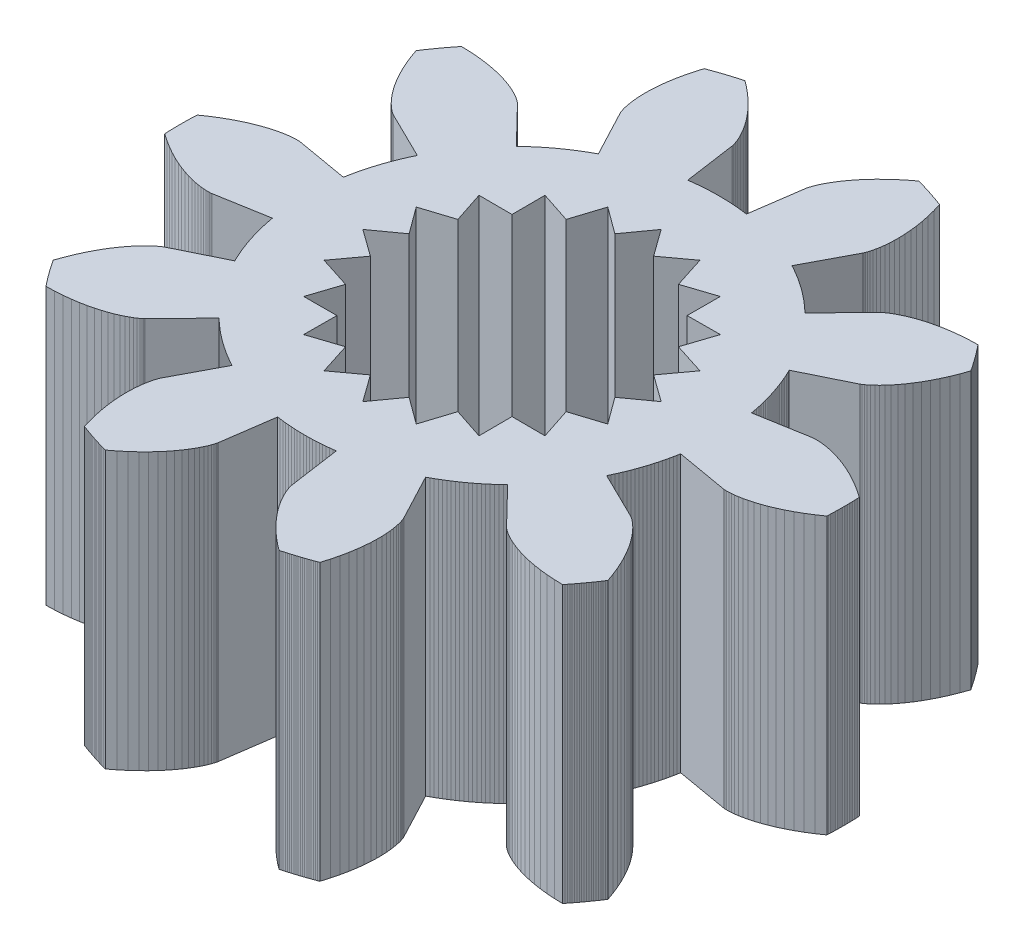
from build123d import *

# Parameters (mm, degrees)
BOSS_EXTRUDE1_DEPTH = 5
SKETCH2_R           = 1.5
CUT_EXTRUDE1_DEPTH  = 10.722497268
CUT_EXTRUDE2_DEPTH  = 10.722497268


with BuildPart() as part:
    # Sketch1 → Boss-Extrude1 (new body)
    with BuildSketch(Plane(origin=(0, 0, 0), x_dir=(1, 0, 0), z_dir=(0, 1, 0))):
        Polygon((3.6946769, -0.6417654), (4.6291475, -0.8040829), (4.6332094, -0.8046724), (4.6454524, -0.8059869), (4.6659298, -0.8073423), (4.6946521, -0.8080515), (4.7315867, -0.8074275), (4.7766581, -0.8047855), (4.8297479, -0.7994452), (4.8906949, -0.7907331), (4.9592959, -0.7779854), (5.035306, -0.7605497), (5.1184393, -0.7377878), (5.2083696, -0.7090775), (5.3047313, -0.6738155), (5.4071205, -0.631419), (5.515096, -0.5813282), (5.6281806, -0.523008), (5.7458624, -0.4559506), (5.8675963, -0.379677), (5.9928055, -0.2937389), (5.9942402, -0.26284), (5.9955155, -0.2319341), (5.9966316, -0.201022), (5.9975882, -0.1701046), (5.9983855, -0.1391826), (5.9990233, -0.108257), (5.9995017, -0.0773285), (5.9998206, -0.0463979), (5.9999801, -0.0154661), (5.9999801, 0.0154661), (5.9998206, 0.0463979), (5.9995017, 0.0773285), (5.9990233, 0.108257), (5.9983855, 0.1391826), (5.9975882, 0.1701046), (5.9966316, 0.201022), (5.9955155, 0.2319341), (5.9942402, 0.26284), (5.9928055, 0.2937389), (5.8675963, 0.379677), (5.7458624, 0.4559506), (5.6281806, 0.523008), (5.515096, 0.5813282), (5.4071205, 0.631419), (5.3047313, 0.6738155), (5.2083696, 0.7090775), (5.1184393, 0.7377878), (5.035306, 0.7605497), (4.9592959, 0.7779854), (4.8906949, 0.7907331), (4.8297479, 0.7994452), (4.7766581, 0.8047855), (4.7315867, 0.8074275), (4.6946521, 0.8080515), (4.6659298, 0.8073423), (4.6454524, 0.8059869), (4.6332094, 0.8046724), (4.6291475, 0.8040829), (3.6946769, 0.6417654), (3.6846589, 0.6969853), (3.6738157, 0.7520491), (3.6621497, 0.8069445), (3.6496635, 0.8616591), (3.6363598, 0.9161808), (3.6222417, 0.9704972), (3.6073123, 1.0245963), (3.591575, 1.078466), (3.5750333, 1.132094), (3.5576909, 1.1854685), (3.5395516, 1.2385775), (3.5206196, 1.2914091), (3.5008991, 1.3439515), (3.4803944, 1.3961929), (3.4591103, 1.4481215), (3.4370514, 1.4997258), (3.4142227, 1.5509942), (3.3906294, 1.6019152), (3.3662766, 1.6524775), (4.217687, 2.0704279), (4.2213197, 2.0723385), (4.2319972, 2.0784713), (4.2493604, 2.0894111), (4.2730141, 2.1057199), (4.3025281, 2.1279343), (4.3374387, 2.156564), (4.3772502, 2.1920898), (4.4214365, 2.2349618), (4.469443, 2.2855975), (4.520688, 2.3443809), (4.5745651, 2.4116603), (4.6304448, 2.4877471), (4.6876766, 2.5729146), (4.7455911, 2.6673969), (4.8035025, 2.7713877), (4.8607101, 2.8850392), (4.9165014, 3.0084614), (4.9701537, 3.1417214), (5.0209369, 3.2848429), (5.0039356, 3.3106839), (4.9868014, 3.336437), (4.9695346, 3.3621014), (4.9521358, 3.3876764), (4.9346053, 3.4131614), (4.9169437, 3.4385557), (4.8991514, 3.4638585), (4.8812288, 3.4890694), (4.8631766, 3.5141875), (4.8449951, 3.5392121), (4.8266848, 3.5641428), (4.8082463, 3.5889787), (4.7896799, 3.6137192), (4.7709863, 3.6383636), (4.7521658, 3.6629114), (4.7332191, 3.6873618), (4.7141465, 3.7117142), (4.6949487, 3.735968), (4.6756261, 3.7601225), (4.5238166, 3.7560517), (4.3804993, 3.746205), (4.2458773, 3.7312839), (4.1201102, 3.7119964), (4.0033136, 3.6890544), (3.8955589, 3.663171), (3.7968742, 3.6350586), (3.7072436, 3.605426), (3.6266082, 3.5749763), (3.5548663, 3.5444044), (3.491874, 3.5143949), (3.437446, 3.4856193), (3.3913565, 3.4587344), (3.3533401, 3.4343795), (3.3230926, 3.4131746), (3.3002726, 3.3957183), (3.2845027, 3.3825855), (3.2753706, 3.3743258), (3.2724309, 3.3714613), (2.6118362, 2.6908757), (2.571274, 2.7296611), (2.530136, 2.7678352), (2.4884313, 2.8053894), (2.4461693, 2.8423152), (2.4033593, 2.8786045), (2.3600111, 2.914249), (2.3161344, 2.9492408), (2.2717388, 2.9835721), (2.2268345, 3.0172352), (2.1814314, 3.0502224), (2.1355398, 3.0825265), (2.0891698, 3.1141402), (2.042332, 3.1450565), (1.9950367, 3.1752683), (1.9472946, 3.2047689), (1.8991163, 3.2335518), (1.8505127, 3.2616105), (1.8014946, 3.2889386), (1.7520731, 3.3155301), (2.1952135, 4.1541056), (2.1970294, 4.1577866), (2.2020629, 4.1690241), (2.2096797, 4.1880805), (2.2192299, 4.2151778), (2.2300499, 4.2504976), (2.2414651, 4.2941794), (2.2527917, 4.346321), (2.2633397, 4.4069772), (2.2724148, 4.4761599), (2.2793209, 4.5538378), (2.2833626, 4.6399361), (2.2838475, 4.7343368), (2.2800888, 4.8368788), (2.2714073, 4.9473579), (2.2571343, 5.0655277), (2.2366136, 5.1910994), (2.2092039, 5.3237434), (2.1742812, 5.463089), (2.1312411, 5.6087264), (2.1022978, 5.6196391), (2.0732986, 5.6304025), (2.0442444, 5.6410163), (2.0151358, 5.6514801), (1.9859736, 5.6617938), (1.9567587, 5.6719569), (1.9274917, 5.6819693), (1.8981736, 5.6918307), (1.868805, 5.7015408), (1.8393867, 5.7110994), (1.8099195, 5.7205062), (1.7804042, 5.729761), (1.7508416, 5.7388634), (1.7212325, 5.7478134), (1.6915776, 5.7566106), (1.6618778, 5.7652547), (1.6321338, 5.7737457), (1.6023464, 5.7820832), (1.5725164, 5.790267), (1.4520927, 5.6977423), (1.3419343, 5.6055363), (1.2417933, 5.5143362), (1.1513824, 5.4248082), (1.0703769, 5.3375964), (0.9984155, 5.2533197), (0.9351019, 5.1725708), (0.8800069, 5.095914), (0.8326693, 5.0238834), (0.7925986, 4.9569814), (0.7592759, 4.8956772), (0.7321566, 4.8404053), (0.710672, 4.7915643), (0.6942315, 4.7495152), (0.6822246, 4.7145811), (0.6740235, 4.6870454), (0.6689846, 4.6671514), (0.6664515, 4.6551015), (0.6657569, 4.6510561), (0.5313628, 3.7121629), (0.4757498, 3.7196992), (0.4200303, 3.7264024), (0.3642167, 3.7322709), (0.3083215, 3.7373036), (0.2523573, 3.7414991), (0.1963365, 3.7448567), (0.1402718, 3.7473756), (0.0841756, 3.7490551), (0.0280606, 3.749895), (-0.0280606, 3.749895), (-0.0841756, 3.7490551), (-0.1402718, 3.7473756), (-0.1963365, 3.7448567), (-0.2523573, 3.7414991), (-0.3083215, 3.7373036), (-0.3642167, 3.7322709), (-0.4200303, 3.7264024), (-0.4757498, 3.7196992), (-0.5313628, 3.7121629), (-0.6657569, 4.6510561), (-0.6664515, 4.6551015), (-0.6689846, 4.6671514), (-0.6740235, 4.6870454), (-0.6822246, 4.7145811), (-0.6942315, 4.7495152), (-0.710672, 4.7915643), (-0.7321566, 4.8404053), (-0.7592759, 4.8956772), (-0.7925986, 4.9569814), (-0.8326693, 5.0238834), (-0.8800069, 5.095914), (-0.9351019, 5.1725708), (-0.9984155, 5.2533197), (-1.0703769, 5.3375964), (-1.1513824, 5.4248082), (-1.2417933, 5.5143362), (-1.3419343, 5.6055363), (-1.4520927, 5.6977423), (-1.5725164, 5.790267), (-1.6023464, 5.7820832), (-1.6321338, 5.7737457), (-1.6618778, 5.7652547), (-1.6915776, 5.7566106), (-1.7212325, 5.7478134), (-1.7508416, 5.7388634), (-1.7804042, 5.729761), (-1.8099195, 5.7205062), (-1.8393867, 5.7110994), (-1.868805, 5.7015408), (-1.8981736, 5.6918307), (-1.9274917, 5.6819693), (-1.9567587, 5.6719569), (-1.9859736, 5.6617938), (-2.0151358, 5.6514801), (-2.0442444, 5.6410163), (-2.0732986, 5.6304025), (-2.1022978, 5.6196391), (-2.1312411, 5.6087264), (-2.1742812, 5.463089), (-2.2092039, 5.3237434), (-2.2366136, 5.1910994), (-2.2571343, 5.0655277), (-2.2714073, 4.9473579), (-2.2800888, 4.8368788), (-2.2838475, 4.7343368), (-2.2833626, 4.6399361), (-2.2793209, 4.5538378), (-2.2724148, 4.4761599), (-2.2633397, 4.4069772), (-2.2527917, 4.346321), (-2.2414651, 4.2941794), (-2.2300499, 4.2504976), (-2.2192299, 4.2151778), (-2.2096797, 4.1880805), (-2.2020629, 4.1690241), (-2.1970294, 4.1577866), (-2.1952135, 4.1541056), (-1.7520731, 3.3155301), (-1.8014946, 3.2889386), (-1.8505127, 3.2616105), (-1.8991163, 3.2335518), (-1.9472946, 3.2047689), (-1.9950367, 3.1752683), (-2.042332, 3.1450565), (-2.0891698, 3.1141402), (-2.1355398, 3.0825265), (-2.1814314, 3.0502224), (-2.2268345, 3.0172352), (-2.2717388, 2.9835721), (-2.3161344, 2.9492408), (-2.3600111, 2.914249), (-2.4033593, 2.8786045), (-2.4461693, 2.8423152), (-2.4884313, 2.8053894), (-2.530136, 2.7678352), (-2.571274, 2.7296611), (-2.6118362, 2.6908757), (-3.2724309, 3.3714613), (-3.2753706, 3.3743258), (-3.2845027, 3.3825855), (-3.3002726, 3.3957183), (-3.3230926, 3.4131746), (-3.3533401, 3.4343795), (-3.3913565, 3.4587344), (-3.437446, 3.4856193), (-3.491874, 3.5143949), (-3.5548663, 3.5444044), (-3.6266082, 3.5749763), (-3.7072436, 3.605426), (-3.7968742, 3.6350586), (-3.8955589, 3.663171), (-4.0033136, 3.6890544), (-4.1201102, 3.7119964), (-4.2458773, 3.7312839), (-4.3804993, 3.746205), (-4.5238166, 3.7560517), (-4.6756261, 3.7601225), (-4.6949487, 3.735968), (-4.7141465, 3.7117142), (-4.7332191, 3.6873618), (-4.7521658, 3.6629114), (-4.7709863, 3.6383636), (-4.7896799, 3.6137192), (-4.8082463, 3.5889787), (-4.8266848, 3.5641428), (-4.8449951, 3.5392121), (-4.8631766, 3.5141875), (-4.8812288, 3.4890694), (-4.8991514, 3.4638585), (-4.9169437, 3.4385557), (-4.9346053, 3.4131614), (-4.9521358, 3.3876764), (-4.9695346, 3.3621014), (-4.9868014, 3.336437), (-5.0039356, 3.3106839), (-5.0209369, 3.2848429), (-4.9701537, 3.1417214), (-4.9165014, 3.0084614), (-4.8607101, 2.8850392), (-4.8035025, 2.7713877), (-4.7455911, 2.6673969), (-4.6876766, 2.5729146), (-4.6304448, 2.4877471), (-4.5745651, 2.4116603), (-4.520688, 2.3443809), (-4.469443, 2.2855975), (-4.4214365, 2.2349618), (-4.3772502, 2.1920898), (-4.3374387, 2.156564), (-4.3025281, 2.1279343), (-4.2730141, 2.1057199), (-4.2493604, 2.0894111), (-4.2319972, 2.0784713), (-4.2213197, 2.0723385), (-4.217687, 2.0704279), (-3.3662766, 1.6524775), (-3.3906294, 1.6019152), (-3.4142227, 1.5509942), (-3.4370514, 1.4997258), (-3.4591103, 1.4481215), (-3.4803944, 1.3961929), (-3.5008991, 1.3439515), (-3.5206196, 1.2914091), (-3.5395516, 1.2385775), (-3.5576909, 1.1854685), (-3.5750333, 1.132094), (-3.591575, 1.078466), (-3.6073123, 1.0245963), (-3.6222417, 0.9704972), (-3.6363598, 0.9161808), (-3.6496635, 0.8616591), (-3.6621497, 0.8069445), (-3.6738157, 0.7520491), (-3.6846589, 0.6969853), (-3.6946769, 0.6417654), (-4.6291475, 0.8040829), (-4.6332094, 0.8046724), (-4.6454524, 0.8059869), (-4.6659298, 0.8073423), (-4.6946521, 0.8080515), (-4.7315867, 0.8074275), (-4.7766581, 0.8047855), (-4.8297479, 0.7994452), (-4.8906949, 0.7907331), (-4.9592959, 0.7779854), (-5.035306, 0.7605497), (-5.1184393, 0.7377878), (-5.2083696, 0.7090775), (-5.3047313, 0.6738155), (-5.4071205, 0.631419), (-5.515096, 0.5813282), (-5.6281806, 0.523008), (-5.7458624, 0.4559506), (-5.8675963, 0.379677), (-5.9928055, 0.2937389), (-5.9942402, 0.26284), (-5.9955155, 0.2319341), (-5.9966316, 0.201022), (-5.9975882, 0.1701046), (-5.9983855, 0.1391826), (-5.9990233, 0.108257), (-5.9995017, 0.0773285), (-5.9998206, 0.0463979), (-5.9999801, 0.0154661), (-5.9999801, -0.0154661), (-5.9998206, -0.0463979), (-5.9995017, -0.0773285), (-5.9990233, -0.108257), (-5.9983855, -0.1391826), (-5.9975882, -0.1701046), (-5.9966316, -0.201022), (-5.9955155, -0.2319341), (-5.9942402, -0.26284), (-5.9928055, -0.2937389), (-5.8675963, -0.379677), (-5.7458624, -0.4559506), (-5.6281806, -0.523008), (-5.515096, -0.5813282), (-5.4071205, -0.631419), (-5.3047313, -0.6738155), (-5.2083696, -0.7090775), (-5.1184393, -0.7377878), (-5.035306, -0.7605497), (-4.9592959, -0.7779854), (-4.8906949, -0.7907331), (-4.8297479, -0.7994452), (-4.7766581, -0.8047855), (-4.7315867, -0.8074275), (-4.6946521, -0.8080515), (-4.6659298, -0.8073423), (-4.6454524, -0.8059869), (-4.6332094, -0.8046724), (-4.6291475, -0.8040829), (-3.6946769, -0.6417654), (-3.6846589, -0.6969853), (-3.6738157, -0.7520491), (-3.6621497, -0.8069445), (-3.6496635, -0.8616591), (-3.6363598, -0.9161808), (-3.6222417, -0.9704972), (-3.6073123, -1.0245963), (-3.591575, -1.078466), (-3.5750333, -1.132094), (-3.5576909, -1.1854685), (-3.5395516, -1.2385775), (-3.5206196, -1.2914091), (-3.5008991, -1.3439515), (-3.4803944, -1.3961929), (-3.4591103, -1.4481215), (-3.4370514, -1.4997258), (-3.4142227, -1.5509942), (-3.3906294, -1.6019152), (-3.3662766, -1.6524775), (-4.217687, -2.0704279), (-4.2213197, -2.0723385), (-4.2319972, -2.0784713), (-4.2493604, -2.0894111), (-4.2730141, -2.1057199), (-4.3025281, -2.1279343), (-4.3374387, -2.156564), (-4.3772502, -2.1920898), (-4.4214365, -2.2349618), (-4.469443, -2.2855975), (-4.520688, -2.3443809), (-4.5745651, -2.4116603), (-4.6304448, -2.4877471), (-4.6876766, -2.5729146), (-4.7455911, -2.6673969), (-4.8035025, -2.7713877), (-4.8607101, -2.8850392), (-4.9165014, -3.0084614), (-4.9701537, -3.1417214), (-5.0209369, -3.2848429), (-5.0039356, -3.3106839), (-4.9868014, -3.336437), (-4.9695346, -3.3621014), (-4.9521358, -3.3876764), (-4.9346053, -3.4131614), (-4.9169437, -3.4385557), (-4.8991514, -3.4638585), (-4.8812288, -3.4890694), (-4.8631766, -3.5141875), (-4.8449951, -3.5392121), (-4.8266848, -3.5641428), (-4.8082463, -3.5889787), (-4.7896799, -3.6137192), (-4.7709863, -3.6383636), (-4.7521658, -3.6629114), (-4.7332191, -3.6873618), (-4.7141465, -3.7117142), (-4.6949487, -3.735968), (-4.6756261, -3.7601225), (-4.5238166, -3.7560517), (-4.3804993, -3.746205), (-4.2458773, -3.7312839), (-4.1201102, -3.7119964), (-4.0033136, -3.6890544), (-3.8955589, -3.663171), (-3.7968742, -3.6350586), (-3.7072436, -3.605426), (-3.6266082, -3.5749763), (-3.5548663, -3.5444044), (-3.491874, -3.5143949), (-3.437446, -3.4856193), (-3.3913565, -3.4587344), (-3.3533401, -3.4343795), (-3.3230926, -3.4131746), (-3.3002726, -3.3957183), (-3.2845027, -3.3825855), (-3.2753706, -3.3743258), (-3.2724309, -3.3714613), (-2.6118362, -2.6908757), (-2.571274, -2.7296611), (-2.530136, -2.7678352), (-2.4884313, -2.8053894), (-2.4461693, -2.8423152), (-2.4033593, -2.8786045), (-2.3600111, -2.914249), (-2.3161344, -2.9492408), (-2.2717388, -2.9835721), (-2.2268345, -3.0172352), (-2.1814314, -3.0502224), (-2.1355398, -3.0825265), (-2.0891698, -3.1141402), (-2.042332, -3.1450565), (-1.9950367, -3.1752683), (-1.9472946, -3.2047689), (-1.8991163, -3.2335518), (-1.8505127, -3.2616105), (-1.8014946, -3.2889386), (-1.7520731, -3.3155301), (-2.1952135, -4.1541056), (-2.1970294, -4.1577866), (-2.2020629, -4.1690241), (-2.2096797, -4.1880805), (-2.2192299, -4.2151778), (-2.2300499, -4.2504976), (-2.2414651, -4.2941794), (-2.2527917, -4.346321), (-2.2633397, -4.4069772), (-2.2724148, -4.4761599), (-2.2793209, -4.5538378), (-2.2833626, -4.6399361), (-2.2838475, -4.7343368), (-2.2800888, -4.8368788), (-2.2714073, -4.9473579), (-2.2571343, -5.0655277), (-2.2366136, -5.1910994), (-2.2092039, -5.3237434), (-2.1742812, -5.463089), (-2.1312411, -5.6087264), (-2.1022978, -5.6196391), (-2.0732986, -5.6304025), (-2.0442444, -5.6410163), (-2.0151358, -5.6514801), (-1.9859736, -5.6617938), (-1.9567587, -5.6719569), (-1.9274917, -5.6819693), (-1.8981736, -5.6918307), (-1.868805, -5.7015408), (-1.8393867, -5.7110994), (-1.8099195, -5.7205062), (-1.7804042, -5.729761), (-1.7508416, -5.7388634), (-1.7212325, -5.7478134), (-1.6915776, -5.7566106), (-1.6618778, -5.7652547), (-1.6321338, -5.7737457), (-1.6023464, -5.7820832), (-1.5725164, -5.790267), (-1.4520927, -5.6977423), (-1.3419343, -5.6055363), (-1.2417933, -5.5143362), (-1.1513824, -5.4248082), (-1.0703769, -5.3375964), (-0.9984155, -5.2533197), (-0.9351019, -5.1725708), (-0.8800069, -5.095914), (-0.8326693, -5.0238834), (-0.7925986, -4.9569814), (-0.7592759, -4.8956772), (-0.7321566, -4.8404053), (-0.710672, -4.7915643), (-0.6942315, -4.7495152), (-0.6822246, -4.7145811), (-0.6740235, -4.6870454), (-0.6689846, -4.6671514), (-0.6664515, -4.6551015), (-0.6657569, -4.6510561), (-0.5313628, -3.7121629), (-0.4757498, -3.7196992), (-0.4200303, -3.7264024), (-0.3642167, -3.7322709), (-0.3083215, -3.7373036), (-0.2523573, -3.7414991), (-0.1963365, -3.7448567), (-0.1402718, -3.7473756), (-0.0841756, -3.7490551), (-0.0280606, -3.749895), (0.0280606, -3.749895), (0.0841756, -3.7490551), (0.1402718, -3.7473756), (0.1963365, -3.7448567), (0.2523573, -3.7414991), (0.3083215, -3.7373036), (0.3642167, -3.7322709), (0.4200303, -3.7264024), (0.4757498, -3.7196992), (0.5313628, -3.7121629), (0.6657569, -4.6510561), (0.6664515, -4.6551015), (0.6689846, -4.6671514), (0.6740235, -4.6870454), (0.6822246, -4.7145811), (0.6942315, -4.7495152), (0.710672, -4.7915643), (0.7321566, -4.8404053), (0.7592759, -4.8956772), (0.7925986, -4.9569814), (0.8326693, -5.0238834), (0.8800069, -5.095914), (0.9351019, -5.1725708), (0.9984155, -5.2533197), (1.0703769, -5.3375964), (1.1513824, -5.4248082), (1.2417933, -5.5143362), (1.3419343, -5.6055363), (1.4520927, -5.6977423), (1.5725164, -5.790267), (1.6023464, -5.7820832), (1.6321338, -5.7737457), (1.6618778, -5.7652547), (1.6915776, -5.7566106), (1.7212325, -5.7478134), (1.7508416, -5.7388634), (1.7804042, -5.729761), (1.8099195, -5.7205062), (1.8393867, -5.7110994), (1.868805, -5.7015408), (1.8981736, -5.6918307), (1.9274917, -5.6819693), (1.9567587, -5.6719569), (1.9859736, -5.6617938), (2.0151358, -5.6514801), (2.0442444, -5.6410163), (2.0732986, -5.6304025), (2.1022978, -5.6196391), (2.1312411, -5.6087264), (2.1742812, -5.463089), (2.2092039, -5.3237434), (2.2366136, -5.1910994), (2.2571343, -5.0655277), (2.2714073, -4.9473579), (2.2800888, -4.8368788), (2.2838475, -4.7343368), (2.2833626, -4.6399361), (2.2793209, -4.5538378), (2.2724148, -4.4761599), (2.2633397, -4.4069772), (2.2527917, -4.346321), (2.2414651, -4.2941794), (2.2300499, -4.2504976), (2.2192299, -4.2151778), (2.2096797, -4.1880805), (2.2020629, -4.1690241), (2.1970294, -4.1577866), (2.1952135, -4.1541056), (1.7520731, -3.3155301), (1.8014946, -3.2889386), (1.8505127, -3.2616105), (1.8991163, -3.2335518), (1.9472946, -3.2047689), (1.9950367, -3.1752683), (2.042332, -3.1450565), (2.0891698, -3.1141402), (2.1355398, -3.0825265), (2.1814314, -3.0502224), (2.2268345, -3.0172352), (2.2717388, -2.9835721), (2.3161344, -2.9492408), (2.3600111, -2.914249), (2.4033593, -2.8786045), (2.4461693, -2.8423152), (2.4884313, -2.8053894), (2.530136, -2.7678352), (2.571274, -2.7296611), (2.6118362, -2.6908757), (3.2724309, -3.3714613), (3.2753706, -3.3743258), (3.2845027, -3.3825855), (3.3002726, -3.3957183), (3.3230926, -3.4131746), (3.3533401, -3.4343795), (3.3913565, -3.4587344), (3.437446, -3.4856193), (3.491874, -3.5143949), (3.5548663, -3.5444044), (3.6266082, -3.5749763), (3.7072436, -3.605426), (3.7968742, -3.6350586), (3.8955589, -3.663171), (4.0033136, -3.6890544), (4.1201102, -3.7119964), (4.2458773, -3.7312839), (4.3804993, -3.746205), (4.5238166, -3.7560517), (4.6756261, -3.7601225), (4.6949487, -3.735968), (4.7141465, -3.7117142), (4.7332191, -3.6873618), (4.7521658, -3.6629114), (4.7709863, -3.6383636), (4.7896799, -3.6137192), (4.8082463, -3.5889787), (4.8266848, -3.5641428), (4.8449951, -3.5392121), (4.8631766, -3.5141875), (4.8812288, -3.4890694), (4.8991514, -3.4638585), (4.9169437, -3.4385557), (4.9346053, -3.4131614), (4.9521358, -3.3876764), (4.9695346, -3.3621014), (4.9868014, -3.336437), (5.0039356, -3.3106839), (5.0209369, -3.2848429), (4.9701537, -3.1417214), (4.9165014, -3.0084614), (4.8607101, -2.8850392), (4.8035025, -2.7713877), (4.7455911, -2.6673969), (4.6876766, -2.5729146), (4.6304448, -2.4877471), (4.5745651, -2.4116603), (4.520688, -2.3443809), (4.469443, -2.2855975), (4.4214365, -2.2349618), (4.3772502, -2.1920898), (4.3374387, -2.156564), (4.3025281, -2.1279343), (4.2730141, -2.1057199), (4.2493604, -2.0894111), (4.2319972, -2.0784713), (4.2213197, -2.0723385), (4.217687, -2.0704279), (3.3662766, -1.6524775), (3.3906294, -1.6019152), (3.4142227, -1.5509942), (3.4370514, -1.4997258), (3.4591103, -1.4481215), (3.4803944, -1.3961929), (3.5008991, -1.3439515), (3.5206196, -1.2914091), (3.5395516, -1.2385775), (3.5576909, -1.1854685), (3.5750333, -1.132094), (3.591575, -1.078466), (3.6073123, -1.0245963), (3.6222417, -0.9704972), (3.6363598, -0.9161808), (3.6496635, -0.8616591), (3.6621497, -0.8069445), (3.6738157, -0.7520491), (3.6846589, -0.6969853), align=None)
    extrude(amount=BOSS_EXTRUDE1_DEPTH)

    # Sketch2 → Cut-Extrude1 (cut, through all)
    with BuildSketch(Plane(origin=(0, 5, 0), x_dir=(1, 0, 0), z_dir=(0, 1, 0))):
        Circle(SKETCH2_R)
    extrude(amount=-CUT_EXTRUDE1_DEPTH, mode=Mode.SUBTRACT)

    # Sketch4 → Cut-Extrude2 (cut, through all)
    with BuildSketch(Plane(origin=(0, 5, 0), x_dir=(1, 0, 0), z_dir=(0, 1, 0))):
        Polygon((-0.350508913, 2.213026179), (0, 2.7), (0.350508913, 2.213026179), (0.834345885, 2.567852594), (1.017216484, 1.996399758), (1.587020181, 2.184345885), (1.584351818, 1.584351818), (2.184345885, 1.587020181), (1.996399758, 1.017216484), (2.567852594, 0.834345885), (2.213026179, 0.350508913), (2.7, 0), (2.213026179, -0.350508913), (2.567852594, -0.834345885), (1.996399758, -1.017216484), (2.184345885, -1.587020181), (1.584351818, -1.584351818), (1.587020181, -2.184345885), (1.017216484, -1.996399758), (0.834345885, -2.567852594), (0.350508913, -2.213026179), (0, -2.7), (-0.350508913, -2.213026179), (-0.834345885, -2.567852594), (-1.017216484, -1.996399758), (-1.587020181, -2.184345885), (-1.584351818, -1.584351818), (-2.184345885, -1.587020181), (-1.996399758, -1.017216484), (-2.567852594, -0.834345885), (-2.213026179, -0.350508913), (-2.7, 0), (-2.213026179, 0.350508913), (-2.567852594, 0.834345885), (-1.996399758, 1.017216484), (-2.184345885, 1.587020181), (-1.584351818, 1.584351818), (-1.587020181, 2.184345885), (-1.017216484, 1.996399758), (-0.834345885, 2.567852594), align=None)
    extrude(amount=-CUT_EXTRUDE2_DEPTH, mode=Mode.SUBTRACT)


solid = part.part
